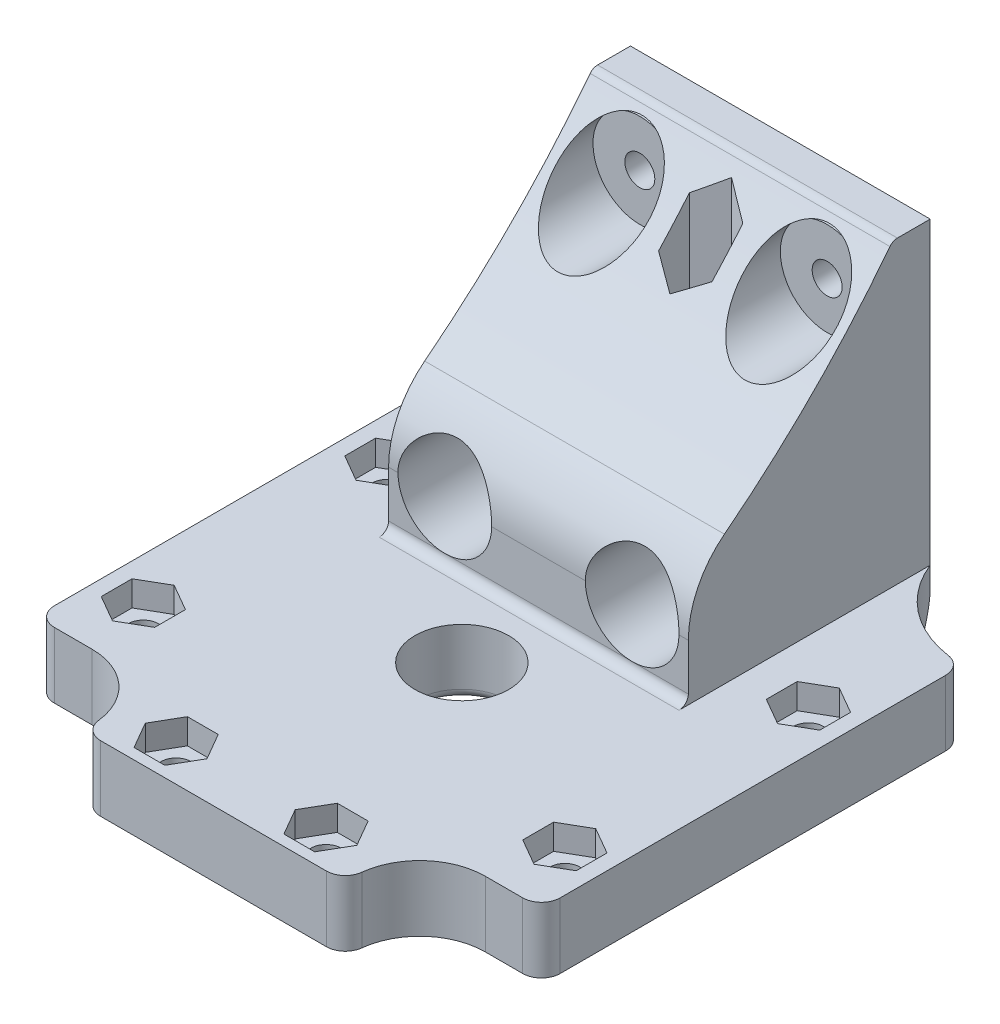
from build123d import *
from OCP.BRepAlgoAPI import BRepAlgoAPI_Cut
from OCP.TopTools import TopTools_ListOfShape
from build123d.topology import SkipClean

# Parameters (mm, degrees)
SKETCH_1_W               = 32
SKETCH_1_H               = 42
SKETCH_1_R               = 1.6
EXTRUDE_1_DEPTH          = 4
SKETCH_2_W               = 40
SKETCH_2_H               = 6
EXTRUDE_2_DEPTH          = 50
SKETCH_4_W               = 32
SKETCH_4_H               = 4
CUT_EXTRUDE_1_DEPTH      = 4
SKETCH_3_R               = 20
EXTRUDE_3_DEPTH          = 12
CUT_EXTRUDE_2_DEPTH      = 76.206382708
CUT_EXTRUDE_START        = -10
CUT_EXTRUDE_3_DEPTH      = 10
EXTRUDE_4_DEPTH          = 12
EXTRUDE_5_DEPTH          = 32
SKETCH_10_R              = 5
CUT_EXTRUDE_4_DEPTH      = 75.565407529
FILLET_12_R              = 1
CUT_EXTRUDE_6_DEPTH      = 73.360210061
CUT_EXTRUDE_START_2      = -11
CUT_EXTRUDE_7_DEPTH      = 11
EXTRUDE_6_DEPTH          = 7
SKETCH_18_W              = 32
SKETCH_18_H              = 8.179844507
CUT_EXTRUDE_8_DEPTH      = 11
FILLET_START             = -1
FILLET_18_DEPTH          = 34
SKETCH_19_R              = 5
SKETCH_19_R_2            = 1.6
EXTRUDE_7_DEPTH          = 1
CUT_EXTRUDE_9_DEPTH      = 81.828522194
CUT_EXTRUDE_9_DEPTH_BACK = 81.828522194
SKETCH_20_R              = 1.6
EXTRUDE_8_DEPTH          = 7
FILLET_21_R              = 5
SKETCH_22_R              = 5
CUT_EXTRUDE_10_DEPTH     = 84.846586148
FILLET_25_R              = 1
FILLET_26_R              = 1
FILLET_27_R              = 2
FILLET_28_R              = 2
CUT_EXTRUDE_11_DEPTH     = 81.828522322
CUT_EXTRUDE_12_DEPTH     = 2.7


with BuildPart() as part:
    # Эскиз1 → Бобышка-Вытянуть1 (new body)
    with BuildSketch(Plane.XY):
        with Locations((16, 21)):
            Rectangle(SKETCH_1_W, SKETCH_1_H)
        with Locations((6, 36)):
            Circle(SKETCH_1_R, mode=Mode.SUBTRACT)
        with Locations((26, 36)):
            Circle(SKETCH_1_R, mode=Mode.SUBTRACT)
        with Locations((6, 16)):
            Circle(SKETCH_1_R, mode=Mode.SUBTRACT)
        with Locations((26, 16)):
            Circle(SKETCH_1_R, mode=Mode.SUBTRACT)
    extrude(amount=EXTRUDE_1_DEPTH)

    # Эскиз2 → Бобышка-Вытянуть2 (add)
    with BuildSketch(Plane.XY.offset(4)):
        with Locations((16, 7)):
            Rectangle(SKETCH_2_W, SKETCH_2_H)
    extrude(amount=EXTRUDE_2_DEPTH)

    # Эскиз4 → Вырез-Вытянуть1 (cut)
    with BuildSketch(Plane.XZ):
        with Locations((16, 2)):
            Rectangle(SKETCH_4_W, SKETCH_4_H)
    extrude(amount=-CUT_EXTRUDE_1_DEPTH, mode=Mode.SUBTRACT)

    # Эскиз3 → Бобышка-Вытянуть3 (add)
    with BuildSketch(Plane.XZ.offset(-4)):
        with Locations(Location((16, 34, 0), (0, 0, 90))):
            Circle(SKETCH_3_R)
    extrude(amount=EXTRUDE_3_DEPTH)

    # Эскиз5 → Вырез-Вытянуть2 (cut, through all)
    with BuildSketch(Plane.XZ.offset(-4)):
        with BuildLine():
            Line((-4, 4), (0, 4))
            ThreePointArc((0, 4), (-2.995594628, 18.86725405), (-4, 34))
            Line((-4, 34), (-4, 4))
        make_face()
        with BuildLine():
            Line((32, 4), (36, 4))
            Line((36, 4), (36, 34))
            ThreePointArc((36, 34), (34.995594628, 18.86725405), (32, 4))
        make_face()
    extrude(amount=-CUT_EXTRUDE_2_DEPTH, mode=Mode.SUBTRACT)

    # Эскиз6 → Вырез-Вытянуть3 (cut)
    with SkipClean():  # the faces are left unmerged after this step: merging them gives an invalid solid
        with BuildSketch(Plane.XZ.offset(-4).offset(CUT_EXTRUDE_START)):
            with BuildLine():
                ThreePointArc((-4, 34), (1.857864376, 48.142135624), (16, 54))
                Line((16, 54), (-4, 54))
                Line((-4, 54), (-4, 34))
            make_face()
            with BuildLine():
                Line((36, 54), (16, 54))
                ThreePointArc((16, 54), (30.142135624, 48.142135624), (36, 34))
                Line((36, 34), (36, 54))
            make_face()
        extrude(amount=CUT_EXTRUDE_3_DEPTH, mode=Mode.SUBTRACT)

    # Эскиз8 → Бобышка-Вытянуть4 (add)
    with BuildSketch(Plane.XZ.offset(-4)):
        with BuildLine():
            Line((32, 0), (32, 4))
            ThreePointArc((32, 4), (34.995594628, 18.86725405), (36, 34))
            ThreePointArc((36, 34), (16, 14), (-4, 34))
            ThreePointArc((-4, 34), (-2.995594628, 18.86725405), (0, 4))
            Line((0, 4), (0, 0))
            Line((0, 0), (32, 0))
        make_face()
    extrude(amount=EXTRUDE_4_DEPTH)

    # Эскиз9 → Бобышка-Вытянуть5 (add)
    with BuildSketch(Plane.ZY):
        with BuildLine():
            Line((4, 42), (4, 10))
            Line((4, 10), (46, 10))
            ThreePointArc((46, 10), (22.849795417, 23.177856485), (4, 42))
        make_face()
    extrude(amount=-EXTRUDE_5_DEPTH)

    # Эскиз10 → Вырез-Вытянуть4 (cut, through all)
    with BuildSketch(Plane(origin=(0, 0, 4), x_dir=(-1, 0, 0), z_dir=(0, 0, -1))):
        with Locations((-26, 36)):
            Circle(SKETCH_10_R)
        with Locations((-6, 36)):
            Circle(SKETCH_10_R)
        with Locations((-6, 16)):
            Circle(SKETCH_10_R)
        with Locations((-26, 16)):
            Circle(SKETCH_10_R)
    extrude(amount=-CUT_EXTRUDE_4_DEPTH, mode=Mode.SUBTRACT)

    # Скругление12
    fillet_12_edges = [part.edges().sort_by_distance(p)[0] for p in [
        (16, 42, 4),
    ]]
    fillet(fillet_12_edges, radius=FILLET_12_R)

    # Эскиз14 → Вырез-Вытянуть6 (cut, through all)
    with BuildSketch(Plane(origin=(0, 10, 0), x_dir=(1, 0, 0), z_dir=(0, 1, 0))):
        with BuildLine():
            Line((-4, -34), (36, -34))
            ThreePointArc((36, -34), (34.973665961, -40.32455532), (32, -46))
            ThreePointArc((32, -46), (16, -54), (0, -46))
            ThreePointArc((0, -46), (-2.973665961, -40.32455532), (-4, -34))
        make_face()
    extrude(amount=CUT_EXTRUDE_6_DEPTH, mode=Mode.SUBTRACT)

    # Эскиз15 → Вырез-Вытянуть7 (cut)
    with BuildSketch(Plane.XZ.offset(8).offset(CUT_EXTRUDE_START_2)):
        with BuildLine():
            Line((0, 4), (0, 0))
            Line((0, 0), (32, 0))
            Line((32, 0), (32, 4))
            ThreePointArc((32, 4), (34.995594628, 18.86725405), (36, 34))
            ThreePointArc((36, 34), (16, 54), (-4, 34))
            ThreePointArc((-4, 34), (-2.995594628, 18.86725405), (0, 4))
        make_face()
    extrude(amount=CUT_EXTRUDE_7_DEPTH, mode=Mode.SUBTRACT)

    # Эскиз16 → Бобышка-Вытянуть6 (add)
    with BuildSketch(Plane.XZ.offset(-3)):
        with BuildLine():
            Line((43, 7.5), (-11, 7.5))
            Line((-11, 7.5), (-11, 52.5))
            Line((-11, 52.5), (-5, 52.5))
            ThreePointArc((-5, 52.5), (-0.050252532, 54.550252532), (2, 59.5))
            Line((2, 59.5), (2, 60.5))
            Line((2, 60.5), (30, 60.5))
            Line((30, 60.5), (30, 59.5))
            ThreePointArc((30, 59.5), (32.050252532, 54.550252532), (37, 52.5))
            Line((37, 52.5), (43, 52.5))
            Line((43, 52.5), (43, 7.5))
        make_face()
    extrude(amount=-EXTRUDE_6_DEPTH)

    # Эскиз18 → Вырез-Вытянуть8 (cut)
    with BuildSketch(Plane(origin=(0, 21, 0), x_dir=(1, 0, 0), z_dir=(0, 1, 0))):
        with Locations((16, -29.910077747)):
            Rectangle(SKETCH_18_W, SKETCH_18_H)
    extrude(amount=-CUT_EXTRUDE_8_DEPTH, mode=Mode.SUBTRACT)


with BuildPart() as fillet_18_tool:
    # Скругление18: read off the stored shape, not the designer's step
    # Скругление18 outline → Скругление18 (new body)
    with BuildSketch(Plane.YZ.offset(FILLET_START)):
        with BuildLine():
            Line((21.00000004, 25.820155521), (15.970539968, 25.820155493))
            ThreePointArc((15.970539968, 25.820155493), (20.358852884, 24.805850222), (23.856948015, 21.968697443))
            ThreePointArc((23.856948015, 21.968697443), (22.405384096, 23.877298752), (21.00000004, 25.820155521))
        make_face()
    extrude(amount=FILLET_18_DEPTH)


with BuildPart() as part_1:
    add(part.part)

    # Скругление18: cut by fillet_18_tool, with a tolerance
    fillet_18_stock = TopTools_ListOfShape()
    fillet_18_stock.Append(part_1.part.wrapped)
    fillet_18_tools = TopTools_ListOfShape()
    fillet_18_tools.Append(fillet_18_tool.part.wrapped)
    fillet_18_cut = BRepAlgoAPI_Cut()
    fillet_18_cut.SetArguments(fillet_18_stock)
    fillet_18_cut.SetTools(fillet_18_tools)
    fillet_18_cut.SetFuzzyValue(0.00001)
    fillet_18_cut.Build()
    add(Compound.cast(fillet_18_cut.Shape()).solids(), mode=Mode.REPLACE)

    # Эскиз19 → Бобышка-Вытянуть7 (add)
    # profile 1 of 4: a face of its own
    with BuildSketch(Plane.XY.offset(4)):
        with Locations((6, 36)):
            Circle(SKETCH_19_R)
        with Locations((6, 36)):
            Circle(SKETCH_19_R_2, mode=Mode.SUBTRACT)
    # profile 2 of 4: a face of its own
    with BuildSketch(Plane.XY.offset(4)):
        with Locations((26, 36)):
            Circle(SKETCH_19_R)
        with Locations((26, 36)):
            Circle(SKETCH_19_R_2, mode=Mode.SUBTRACT)
    # profile 3 of 4: a face of its own
    with BuildSketch(Plane.XY.offset(4)):
        with Locations(Location((6, 16, 0), (0, 0, 180.337589052))):
            Circle(SKETCH_19_R)
        with Locations((6, 16)):
            Circle(SKETCH_19_R_2, mode=Mode.SUBTRACT)
    # profile 4 of 4: a face of its own
    with BuildSketch(Plane.XY.offset(4)):
        with Locations(Location((26, 16, 0), (0, 0, 180.337589052))):
            Circle(SKETCH_19_R)
        with Locations((26, 16)):
            Circle(SKETCH_19_R_2, mode=Mode.SUBTRACT)
    extrude(amount=EXTRUDE_7_DEPTH)

    # Эскиз20 → Вырез-Вытянуть9 (cut, two sides: drawn at the far end of the back side and taken through both)
    with BuildSketch(Plane(origin=(0, 10, 0), x_dir=(1, 0, 0), z_dir=(0, 1, 0)).offset(-CUT_EXTRUDE_9_DEPTH_BACK)):
        with Locations(Location((38.5, -19.5, 0), (0, 0, 270))):
            Circle(SKETCH_20_R)
        with Locations(Location((38.5, -45.5, 0), (0, 0, 270))):
            Circle(SKETCH_20_R)
        with Locations(Location((-6.5, -45.5, 0), (0, 0, 270))):
            Circle(SKETCH_20_R)
        with Locations(Location((-6.5, -19.5, 0), (0, 0, 270))):
            Circle(SKETCH_20_R)
        with Locations(Location((24, -56.5, 0), (0, 0, 270))):
            Circle(SKETCH_20_R)
        with Locations(Location((8, -56.5, 0), (0, 0, 270))):
            Circle(SKETCH_20_R)
        with Locations(Location((16, -8.5, 0), (0, 0, 270))):
            Circle(SKETCH_20_R)
    extrude(amount=CUT_EXTRUDE_9_DEPTH + CUT_EXTRUDE_9_DEPTH_BACK, mode=Mode.SUBTRACT)

    # Эскиз21 → Бобышка-Вытянуть8 (add)
    with BuildSketch(Plane.XZ.offset(-3)):
        with BuildLine():
            Line((32.891202525, 7.5), (43, 7.5))
            ThreePointArc((43, 7.5), (36.343236522, 5.446586434), (32, 0))
            Line((32, 0), (32, 4))
            ThreePointArc((32, 4), (32.459402213, 5.746485874), (32.891202525, 7.5))
        make_face()
        with BuildLine():
            Line((0, 4), (0, 0))
            ThreePointArc((0, 0), (-4.343236522, 5.446586434), (-11, 7.5))
            Line((-11, 7.5), (-0.891202525, 7.5))
            ThreePointArc((-0.891202525, 7.5), (-0.459402213, 5.746485874), (0, 4))
        make_face()
    extrude(amount=-EXTRUDE_8_DEPTH)

    # Скругление21
    fillet_21_edges = [part_1.edges().sort_by_distance(p)[0] for p in [
        (16, 3, 0),
    ]]
    fillet(fillet_21_edges, radius=FILLET_21_R)

    # Эскиз22 → Вырез-Вытянуть10 (cut, through all)
    with BuildSketch(Plane.XZ.offset(-3)):
        with Locations(Location((16, 34, 0), (0, 0, 270))):
            Circle(SKETCH_22_R)
    extrude(amount=-CUT_EXTRUDE_10_DEPTH, mode=Mode.SUBTRACT)

    # Скругление25
    fillet_25_edges = [part_1.edges().sort_by_distance(p)[0] for p in [
        (16, 3, 39),
    ]]
    fillet(fillet_25_edges, radius=FILLET_25_R)

    # Скругление26
    fillet_26_edges = [part_1.edges().sort_by_distance(p)[0] for p in [
        (16, 10, 25.820155493),
    ]]
    fillet(fillet_26_edges, radius=FILLET_26_R - 0.0001)  # a hair under: the kernel refuses the full size

    # Скругление27
    fillet_27_edges = [part_1.edges().sort_by_distance(p)[0] for p in [
        (30, 6.5, 60.5),
        (2, 6.5, 60.5),
        (-11, 6.5, 52.5),
        (43, 6.5, 52.5),
    ]]
    fillet(fillet_27_edges, radius=FILLET_27_R)

    # Скругление28
    fillet_28_edges = [part_1.edges().sort_by_distance(p)[0] for p in [
        (43, 6.5, 7.5),
        (-11, 6.5, 7.5),
    ]]
    fillet(fillet_28_edges, radius=FILLET_28_R)

    # Эскиз23 → Вырез-Вытянуть11 (cut, through all)
    with BuildSketch(Plane(origin=(0, 10, 0), x_dir=(1, 0, 0), z_dir=(0, 1, 0))):
        Polygon((18.85, -10.145448267), (18.85, -6.854551733), (16, -5.209103466), (13.15, -6.854551733), (13.15, -10.145448267), (16, -11.790896534), align=None)
    extrude(amount=CUT_EXTRUDE_11_DEPTH, mode=Mode.SUBTRACT)

    # Эскиз24 → Вырез-Вытянуть12 (cut)
    with BuildSketch(Plane(origin=(0, 10, 0), x_dir=(1, 0, 0), z_dir=(0, 1, 0))):
        Polygon((-3.65, -43.854551733), (-6.5, -42.209103466), (-9.35, -43.854551733), (-9.35, -47.145448267), (-6.5, -48.790896534), (-3.65, -47.145448267), align=None)
        Polygon((11.290896534, -56.5), (9.645448267, -53.65), (6.354551733, -53.65), (4.709103466, -56.5), (6.354551733, -59.35), (9.645448267, -59.35), align=None)
        Polygon((27.290896534, -56.5), (25.645448267, -53.65), (22.354551733, -53.65), (20.709103466, -56.5), (22.354551733, -59.35), (25.645448267, -59.35), align=None)
        Polygon((38.5, -42.209103466), (35.65, -43.854551733), (35.65, -47.145448267), (38.5, -48.790896534), (41.35, -47.145448267), (41.35, -43.854551733), align=None)
        Polygon((41.35, -21.145448267), (41.35, -17.854551733), (38.5, -16.209103466), (35.65, -17.854551733), (35.65, -21.145448267), (38.5, -22.790896534), align=None)
        Polygon((-3.65, -21.145448267), (-3.65, -17.854551733), (-6.5, -16.209103466), (-9.35, -17.854551733), (-9.35, -21.145448267), (-6.5, -22.790896534), align=None)
    extrude(amount=-CUT_EXTRUDE_12_DEPTH, mode=Mode.SUBTRACT)


solid = part_1.part
